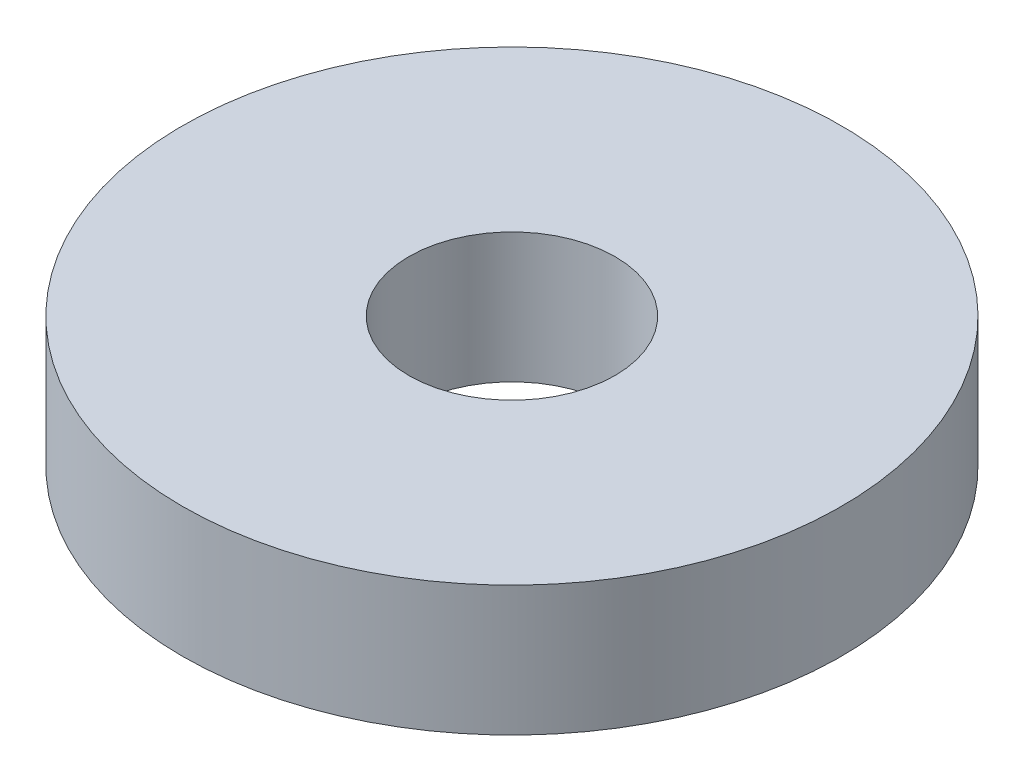
from build123d import *

# Parameters (mm, degrees)
SKETCH1_R           = 7.613586195
SKETCH1_R_2         = 2.38125
BOSS_EXTRUDE1_DEPTH = 3


with BuildPart() as part:
    # Sketch1 → Boss-Extrude1 (new body)
    with BuildSketch(Plane(origin=(0, 0, 0), x_dir=(1, 0, 0), z_dir=(0, 1, 0))):
        Circle(SKETCH1_R)
        Circle(SKETCH1_R_2, mode=Mode.SUBTRACT)
    extrude(amount=BOSS_EXTRUDE1_DEPTH)


solid = part.part
